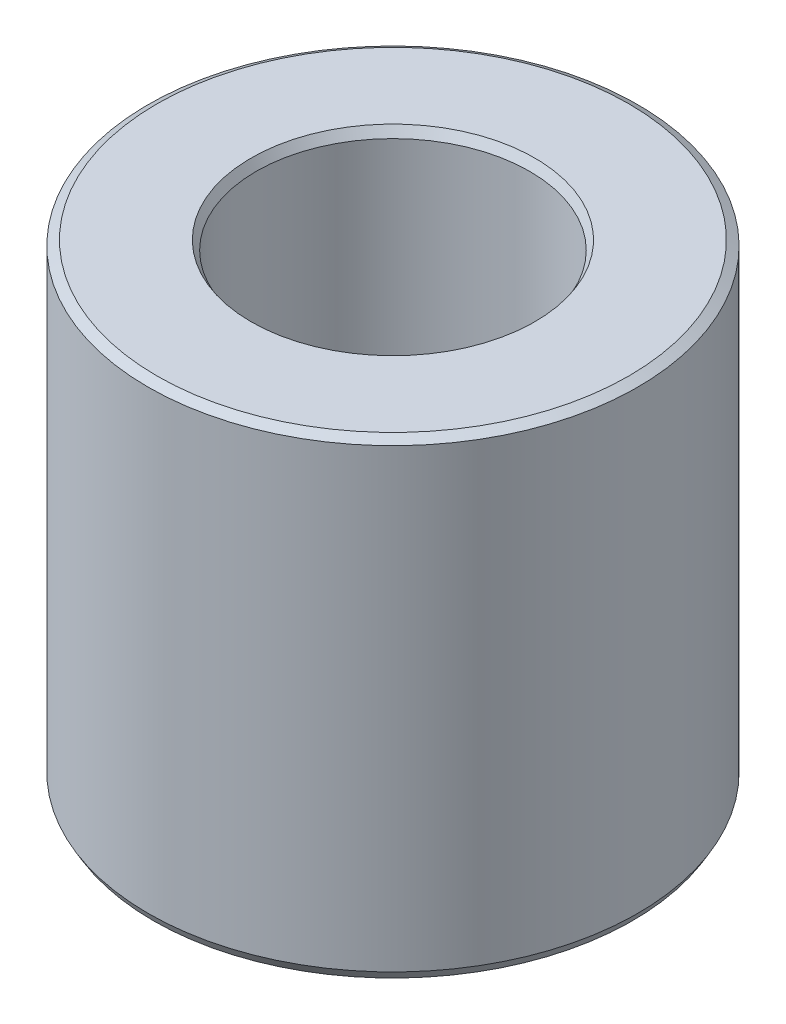
from build123d import *
from OCP.BRepFilletAPI import BRepFilletAPI_MakeChamfer

# Parameters (mm, degrees)
SKETCH1_R           = 10
BOSS_EXTRUDE1_DEPTH = 19.195475341
SKETCH2_R           = 5.585067889
CUT_EXTRUDE1_DEPTH  = 24.842530771
CHAMFER1_SIZE       = 0.210762509
CHAMFER1_SIZE2      = 0.365051373


with BuildPart() as part:
    # Sketch1 → Boss-Extrude1 (new body)
    with BuildSketch(Plane(origin=(0, 0, 0), x_dir=(1, 0, 0), z_dir=(0, 1, 0))):
        Circle(SKETCH1_R)
    extrude(amount=BOSS_EXTRUDE1_DEPTH)

    # Sketch2 → Cut-Extrude1 (cut, through all)
    with BuildSketch(Plane(origin=(0, 0, 0), x_dir=(1, 0, 0), z_dir=(0, 1, 0))):
        Circle(SKETCH2_R)
    extrude(amount=CUT_EXTRUDE1_DEPTH, mode=Mode.SUBTRACT)

    # Chamfer1: one chamfer whose edges measure the first distance from different faces: ONE call of the kernel's chamfer builder (chamfer() names one face for all edges)
    chamfer1_edges_1 = [part.edges().sort_by_distance(p)[0] for p in [
        (-5.585067889, 19.195475341, 0),
    ]]
    chamfer1_side_1 = [part.faces().sort_by_distance(p)[0] for p in [
        (-9.717157288, 19.195475341, 0),
    ]]
    chamfer1_edges_2 = [part.edges().sort_by_distance(p)[0] for p in [
        (-5.585067889, 0, 0),
    ]]
    chamfer1_side_2 = [part.faces().sort_by_distance(p)[0] for p in [
        (-5.585067889, 9.597737671, 0),
    ]]
    chamfer1_edges_3 = [part.edges().sort_by_distance(p)[0] for p in [
        (-10, 0, 0),
    ]]
    chamfer1_side_3 = [part.faces().sort_by_distance(p)[0] for p in [
        (-9.717157288, 0, 0),
    ]]
    chamfer1_edges_4 = [part.edges().sort_by_distance(p)[0] for p in [
        (-10, 19.195475341, 0),
    ]]
    chamfer1_side_4 = [part.faces().sort_by_distance(p)[0] for p in [
        (-10, 9.597737671, 0),
    ]]
    chamfer1 = BRepFilletAPI_MakeChamfer(part.part.solid().wrapped)
    for e in chamfer1_edges_1:
        chamfer1.Add(CHAMFER1_SIZE, CHAMFER1_SIZE2, e.wrapped, chamfer1_side_1[0].wrapped)  # the first distance lies on this face
    for e in chamfer1_edges_2:
        chamfer1.Add(CHAMFER1_SIZE, CHAMFER1_SIZE2, e.wrapped, chamfer1_side_2[0].wrapped)  # the first distance lies on this face
    for e in chamfer1_edges_3:
        chamfer1.Add(CHAMFER1_SIZE, CHAMFER1_SIZE2, e.wrapped, chamfer1_side_3[0].wrapped)  # the first distance lies on this face
    for e in chamfer1_edges_4:
        chamfer1.Add(CHAMFER1_SIZE, CHAMFER1_SIZE2, e.wrapped, chamfer1_side_4[0].wrapped)  # the first distance lies on this face
    add(Compound.cast(chamfer1.Shape()), mode=Mode.REPLACE)


solid = part.part
